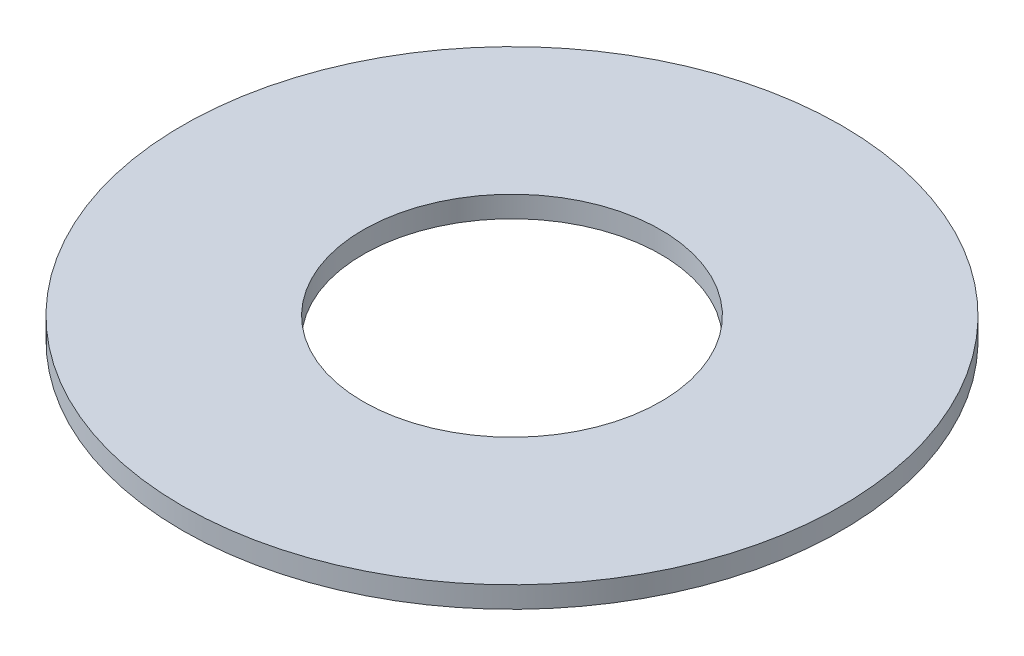
from build123d import *

# Parameters (mm, degrees)
SKETCH1_R           = 77.5
BOSS_EXTRUDE1_DEPTH = 5
SKETCH2_R           = 35
CUT_EXTRUDE1_DEPTH  = 110.715541287


with BuildPart() as part:
    # Sketch1 → Boss-Extrude1 (new body)
    with BuildSketch(Plane(origin=(0, 0, 0), x_dir=(1, 0, 0), z_dir=(0, 1, 0))):
        Circle(SKETCH1_R)
    extrude(amount=BOSS_EXTRUDE1_DEPTH)

    # Sketch2 → Cut-Extrude1 (cut, through all)
    with BuildSketch(Plane(origin=(0, 0, 0), x_dir=(1, 0, 0), z_dir=(0, 1, 0))):
        Circle(SKETCH2_R)
    extrude(amount=CUT_EXTRUDE1_DEPTH, mode=Mode.SUBTRACT)


solid = part.part
